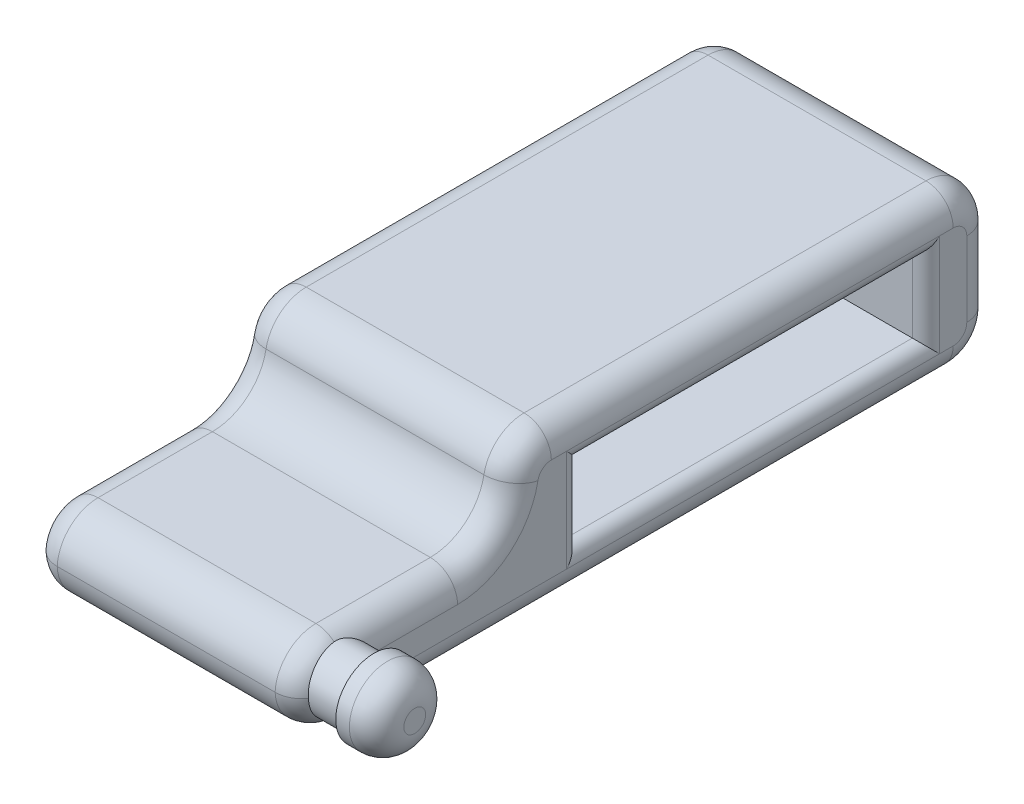
from build123d import *

# Parameters (mm, degrees)
SKETCH1_W           = 20
SKETCH1_H           = 25.4
BOSS_EXTRUDE1_DEPTH = 11.5
SKETCH1_3_W         = 20
SKETCH1_3_H         = 25.4
BOSS_EXTRUDE2_DEPTH = 5.75
SKETCH3_W           = 20
SKETCH3_H           = 5.75
BOSS_EXTRUDE3_DEPTH = 10
SKETCH4_W           = 25.4
SKETCH4_H           = 5.5
CUT_EXTRUDE1_DEPTH  = 43.233437778
FILLET1_R           = 1
FILLET2_R           = 1
FILLET3_R           = 3
FILLET4_R           = 3
FILLET5_R           = 4
FILLET6_R           = 3
SKETCH6_R           = 2.299110901
BOSS_EXTRUDE4_DEPTH = 2
FILLET7_R           = 3
SKETCH8_R           = 2.8
BOSS_EXTRUDE6_DEPTH = 3
FILLET9_R           = 2
FILLET10_R          = 2
FILLET11_R          = 2


with BuildPart() as part:
    # Sketch1 → Boss-Extrude1 (new body)
    with BuildSketch(Plane(origin=(0, 0, 0), x_dir=(1, 0, 0), z_dir=(0, 1, 0))):
        with Locations((10.626362144, 2.72467998)):
            Rectangle(SKETCH1_W, SKETCH1_H)
    extrude(amount=BOSS_EXTRUDE1_DEPTH)

    # Sketch1<3> → Boss-Extrude2 (add)
    with BuildSketch(Plane(origin=(0, 0, 0), x_dir=(1, 0, 0), z_dir=(0, 1, 0))):
        with Locations((10.626362144, -22.67532002)):
            Rectangle(SKETCH1_3_W, SKETCH1_3_H)
    extrude(amount=BOSS_EXTRUDE2_DEPTH)

    # Sketch3 → Boss-Extrude3 (add)
    with BuildSketch(Plane.XY.offset(9.97532002)):
        with Locations((10.626362144, 8.625)):
            Rectangle(SKETCH3_W, SKETCH3_H)
    extrude(amount=BOSS_EXTRUDE3_DEPTH)

    # Sketch4 → Cut-Extrude1 (cut, through all)
    with BuildSketch(Plane(origin=(20.626362144, 0, 0), x_dir=(0, 0, -1), z_dir=(1, 0, 0))):
        with Locations((-2.27532002, 5.75)):
            Rectangle(SKETCH4_W, SKETCH4_H)
    extrude(amount=-CUT_EXTRUDE1_DEPTH, mode=Mode.SUBTRACT)

    # Fillet1
    fillet1_edges = [part.edges().sort_by_distance(p)[0] for p in [
        (20.626362144, 5.75, 14.97532002),
        (20.626362144, 3, 2.27532002),
        (20.626362144, 5.75, -10.42467998),
        (20.626362144, 8.5, 2.27532002),
    ]]
    fillet(fillet1_edges, radius=FILLET1_R)

    # Fillet2
    fillet2_edges = [part.edges().sort_by_distance(p)[0] for p in [
        (0.626362144, 5.75, 14.97532002),
        (0.626362144, 8.5, 2.27532002),
        (0.626362144, 5.75, -10.42467998),
        (0.626362144, 3, 2.27532002),
    ]]
    fillet(fillet2_edges, radius=FILLET2_R)

    # Fillet3
    fillet3_edges = [part.edges().sort_by_distance(p)[0] for p in [
        (10.626362144, 11.5, -15.42467998),
    ]]
    fillet(fillet3_edges, radius=FILLET3_R)

    # Fillet4
    fillet4_edges = [part.edges().sort_by_distance(p)[0] for p in [
        (10.626362144, 0, -15.42467998),
    ]]
    fillet(fillet4_edges, radius=FILLET4_R)

    # Fillet5
    fillet5_edges = [part.edges().sort_by_distance(p)[0] for p in [
        (10.626362144, 5.75, 19.97532002),
    ]]
    fillet(fillet5_edges, radius=FILLET5_R)

    # Fillet6
    fillet6_edges = [part.edges().sort_by_distance(p)[0] for p in [
        (10.626362144, 11.5, 19.97532002),
    ]]
    fillet(fillet6_edges, radius=FILLET6_R)

    # Sketch6 → Boss-Extrude4 (add)
    with BuildSketch(Plane(origin=(20.626362144, 0, 0), x_dir=(0, 0, -1), z_dir=(1, 0, 0))):
        with Locations((-32.243815698, 2.949635855)):
            Circle(SKETCH6_R)
    extrude(amount=BOSS_EXTRUDE4_DEPTH)

    # Fillet7
    # the kernel refuses this fillet: 3 mm, written as the material it takes off along each edge
    with BuildSketch(Plane(origin=(-6.873637856, 0, 35.37532002), x_dir=(0, 1, 0), z_dir=(1, 0, 0)), Plane(origin=(-6.873637856, 5.75, 35.37532002), x_dir=(0, 0, -1), z_dir=(1, 0, 0))) as fillet7_piece_1:
        with BuildLine():
            CenterArc((FILLET7_R, -FILLET7_R), FILLET7_R, 90, 90)
            Line((0, -FILLET7_R), (0, 0))
            Line((0, 0), (FILLET7_R, 0))
        make_face()
    extrude(amount=35, mode=Mode.SUBTRACT)

    # Sketch8 → Boss-Extrude6 (add)
    with BuildSketch(Plane(origin=(22.626362144, 0, 0), x_dir=(0, 0, -1), z_dir=(1, 0, 0))):
        with Locations((-32.118132116, 2.923606681)):
            Circle(SKETCH8_R)
    extrude(amount=BOSS_EXTRUDE6_DEPTH)

    # Fillet9
    fillet9_edges = [part.edges().sort_by_distance(p)[0] for p in [
        (25.626362144, 2.923606681, 34.918132116),
    ]]
    fillet(fillet9_edges, radius=FILLET9_R)

    # Fillet10
    # the kernel refuses this fillet: 2 mm, written as the material it takes off along each edge
    with BuildSketch(Plane(origin=(0.626362144, 9.75, 23.97532002), x_dir=(0, -0.17857142857142888, -0.9839269509968508), z_dir=(0, 0.9839269509968508, -0.17857142857142888))) as fillet10_piece_1:
        with BuildLine():
            CenterArc((4 + FILLET10_R, -FILLET10_R), FILLET10_R, 90, 90)
            Line((4 + FILLET10_R, 0), (4, 0))
            Line((4, 0), (4, -FILLET10_R))
        make_face()
    revolve(axis=Axis((0.626362144, 9.75, 23.97532002), (-1, 0, 0)), revolution_arc=79.713439389, mode=Mode.SUBTRACT)
    with BuildSketch(Plane(origin=(0.626362144, 8.500000013, 17.087831374), x_dir=(0, 0.17857142509559704, 0.9839269516276742), z_dir=(0, -0.9839269516276742, 0.17857142509559704))) as fillet10_piece_2:
        with BuildLine():
            CenterArc((2.999999987 - FILLET10_R * 1.00000000192, -FILLET10_R), FILLET10_R, 360, 90)
            Line((2.999999987 - FILLET10_R * 1.00000000192, 0), (2.999999987, 0))
            Line((2.999999987, 0), (2.999999987 - FILLET10_R * 1.92114524289e-09, -FILLET10_R))
        make_face()
    revolve(axis=Axis((0.626362144, 8.500000013, 17.087831374), (-1, 0, 0)), revolution_arc=79.713439793, mode=Mode.SUBTRACT)
    with BuildSketch(Plane(origin=(0.626362144, 2.75, 32.37532002), x_dir=(0, -0.9984974283407907, -0.05479859119382269), z_dir=(0, 0.05479859119382269, -0.9984974283407907))) as fillet10_piece_3:
        with BuildLine():
            CenterArc((3 - FILLET10_R, -FILLET10_R), FILLET10_R, 0, 90)
            Line((3 - FILLET10_R, 0), (3, 0))
            Line((3, 0), (3, -FILLET10_R))
        make_face()
    revolve(axis=Axis((0.626362144, 2.75, 32.37532002), (-1, 0, 0)), revolution_arc=183.1413015, mode=Mode.SUBTRACT)
    with BuildSketch(Plane(origin=(0.626362144, 3, 32.37532002), x_dir=(0, -1, 0), z_dir=(0, 0, -1))) as fillet10_piece_4:
        with BuildLine():
            CenterArc((3 - FILLET10_R, -FILLET10_R), FILLET10_R, 0, 90)
            Line((3 - FILLET10_R, 0), (3, 0))
            Line((3, 0), (3, -FILLET10_R))
        make_face()
    revolve(axis=Axis((0.626362144, 3, 32.37532002), (-1, 0, 0)), revolution_arc=183.1413015, mode=Mode.SUBTRACT)
    with BuildSketch(Plane(origin=(0.626362144, 3, -15.42467998), x_dir=(1, 0, 0), z_dir=(0, 1, 0))) as fillet10_piece_5:
        with BuildLine():
            CenterArc((FILLET10_R, -FILLET10_R), FILLET10_R, 90, 90)
            Line((0, -FILLET10_R), (0, 0))
            Line((0, 0), (FILLET10_R, 0))
        make_face()
    extrude(amount=5.5, mode=Mode.SUBTRACT)
    with BuildSketch(Plane(origin=(0.626362144, 11.5, 17.087831364), x_dir=(1, 0, 0), z_dir=(0, 0, -1))) as fillet10_piece_6:
        with BuildLine():
            CenterArc((FILLET10_R, FILLET10_R), FILLET10_R, 180, 90)
            Line((0, FILLET10_R), (0, 0))
            Line((0, 0), (FILLET10_R, 0))
        make_face()
    extrude(amount=29.512511343, mode=Mode.SUBTRACT)
    with BuildSketch(Plane(origin=(0.626362144, 8.5, -12.42467998), x_dir=(0, 0, -1), z_dir=(0, -1, 0))) as fillet10_piece_7:
        with BuildLine():
            CenterArc((3 - FILLET10_R, FILLET10_R), FILLET10_R, 270, 90)
            Line((3 - FILLET10_R, 0), (3, 0))
            Line((3, 0), (3, FILLET10_R))
        make_face()
    revolve(axis=Axis((0.626362144, 8.5, -12.42467998), (1, 0, 0)), revolution_arc=90, mode=Mode.SUBTRACT)
    with BuildSketch(Plane(origin=(0.626362144, 0, -12.42467998), x_dir=(1, 0, 0), z_dir=(0, 0, 1))) as fillet10_piece_8:
        with BuildLine():
            CenterArc((FILLET10_R, FILLET10_R), FILLET10_R, 180, 90)
            Line((0, FILLET10_R), (0, 0))
            Line((0, 0), (FILLET10_R, 0))
        make_face()
    extrude(amount=44.8, mode=Mode.SUBTRACT)
    with BuildSketch(Plane(origin=(0.626362144, 3, -12.42467998), x_dir=(0, 0, -1), z_dir=(0, 1, 0))) as fillet10_piece_9:
        with BuildLine():
            CenterArc((3 - FILLET10_R, -FILLET10_R), FILLET10_R, 0, 90)
            Line((3 - FILLET10_R, 0), (3, 0))
            Line((3, 0), (3, -FILLET10_R))
        make_face()
    revolve(axis=Axis((0.626362144, 3, -12.42467998), (-1, 0, 0)), revolution_arc=90, mode=Mode.SUBTRACT)
    with BuildSketch(Plane(origin=(0.626362144, 5.75, 23.97532002), x_dir=(1, 0, 0), z_dir=(0, 0, 1))) as fillet10_piece_10:
        with BuildLine():
            CenterArc((FILLET10_R, -FILLET10_R), FILLET10_R, 90, 90)
            Line((0, -FILLET10_R), (0, 0))
            Line((0, 0), (FILLET10_R, 0))
        make_face()
    extrude(amount=8.4, mode=Mode.SUBTRACT)

    # Fillet11
    # the kernel refuses this fillet: 2 mm, written as the material it takes off along each edge
    with BuildSketch(Plane(origin=(20.626362144, 0, 32.37532002), x_dir=(0, 1, 0), z_dir=(0, 0, -1))) as fillet11_piece_1_section:
        with BuildLine():
            CenterArc((FILLET11_R, -FILLET11_R), FILLET11_R, 90, 90)
            Line((0, -FILLET11_R), (0, 0))
            Line((0, 0), (FILLET11_R, 0))
        make_face()
    fillet11_piece_1 = extrude(amount=44.8, mode=Mode.PRIVATE)
    fillet11_piece_1 = fillet11_piece_1 - Plane(origin=(20.626362144, 2.949635855, 32.243815698), x_dir=(0, 0, -1), z_dir=(-1, 0, 0)) * Cylinder(2.299110901, 98, mode=Mode.PRIVATE)
    add(fillet11_piece_1, mode=Mode.SUBTRACT)
    with BuildSketch(Plane(origin=(20.626362144, 3, -12.42467998), x_dir=(0, 0, -1), z_dir=(0, 1, 0))) as fillet11_piece_2:
        with BuildLine():
            CenterArc((3 - FILLET11_R, FILLET11_R), FILLET11_R, 270, 90)
            Line((3, FILLET11_R), (3, 0))
            Line((3, 0), (3 - FILLET11_R, 0))
        make_face()
    revolve(axis=Axis((20.626362144, 3, -12.42467998), (-1, 0, 0)), revolution_arc=90, mode=Mode.SUBTRACT)
    with BuildSketch(Plane(origin=(20.626362144, 3, -15.42467998), x_dir=(0, 0, 1), z_dir=(0, 1, 0))) as fillet11_piece_3:
        with BuildLine():
            CenterArc((FILLET11_R, -FILLET11_R), FILLET11_R, 90, 90)
            Line((0, -FILLET11_R), (0, 0))
            Line((0, 0), (FILLET11_R, 0))
        make_face()
    extrude(amount=5.5, mode=Mode.SUBTRACT)
    with BuildSketch(Plane(origin=(20.626362144, 8.5, -12.42467998), x_dir=(0, 0, -1), z_dir=(0, -1, 0))) as fillet11_piece_4:
        with BuildLine():
            CenterArc((3 - FILLET11_R, -FILLET11_R), FILLET11_R, 0, 90)
            Line((3, -FILLET11_R), (3, 0))
            Line((3, 0), (3 - FILLET11_R, 0))
        make_face()
    revolve(axis=Axis((20.626362144, 8.5, -12.42467998), (1, 0, 0)), revolution_arc=90, mode=Mode.SUBTRACT)
    with BuildSketch(Plane(origin=(20.626362144, 5.75, 32.37532002), x_dir=(0, -1, 0), z_dir=(0, 0, -1))) as fillet11_piece_5_section:
        with BuildLine():
            CenterArc((FILLET11_R, FILLET11_R), FILLET11_R, 180, 90)
            Line((0, FILLET11_R), (0, 0))
            Line((0, 0), (FILLET11_R, 0))
        make_face()
    fillet11_piece_5 = extrude(amount=8.4, mode=Mode.PRIVATE)
    fillet11_piece_5 = fillet11_piece_5 - Plane(origin=(20.626362144, 2.949635855, 32.243815698), x_dir=(0, 0, -1), z_dir=(-1, 0, 0)) * Cylinder(2.299110901, 25, mode=Mode.PRIVATE)
    add(fillet11_piece_5, mode=Mode.SUBTRACT)
    with BuildSketch(Plane(origin=(20.626362144, 9.75, 23.97532002), x_dir=(0, -0.17857142857142888, -0.9839269509968508), z_dir=(0, 0.9839269509968508, -0.17857142857142888))) as fillet11_piece_6:
        with BuildLine():
            CenterArc((4 + FILLET11_R, FILLET11_R), FILLET11_R, 180, 90)
            Line((4, FILLET11_R), (4, 0))
            Line((4, 0), (4 + FILLET11_R, 0))
        make_face()
    revolve(axis=Axis((20.626362144, 9.75, 23.97532002), (-1, 0, 0)), revolution_arc=79.713439389, mode=Mode.SUBTRACT)
    with BuildSketch(Plane(origin=(20.626362144, 8.500000013, 17.087831374), x_dir=(0, 0.178571425095601, 0.9839269516276735), z_dir=(0, -0.9839269516276735, 0.178571425095601))) as fillet11_piece_7:
        with BuildLine():
            CenterArc((2.999999987 - FILLET11_R * 1.00000000192, FILLET11_R), FILLET11_R, 270, 90)
            Line((2.999999987 - FILLET11_R * 1.92114324449e-09, FILLET11_R), (2.999999987, 0))
            Line((2.999999987, 0), (2.999999987 - FILLET11_R * 1.00000000192, 0))
        make_face()
    revolve(axis=Axis((20.626362144, 8.500000013, 17.087831374), (-1, 0, 0)), revolution_arc=79.713439793, mode=Mode.SUBTRACT)
    with BuildSketch(Plane(origin=(20.626362144, 11.5, 17.087831364), x_dir=(0, -1, 0), z_dir=(0, 0, -1))) as fillet11_piece_8:
        with BuildLine():
            CenterArc((FILLET11_R, FILLET11_R), FILLET11_R, 180, 90)
            Line((0, FILLET11_R), (0, 0))
            Line((0, 0), (FILLET11_R, 0))
        make_face()
    extrude(amount=29.512511343, mode=Mode.SUBTRACT)
    with BuildSketch(Plane(origin=(20.626362144, 2.75, 32.37532002), x_dir=(0, -0.9984974283407908, -0.05479859119382033), z_dir=(0, 0.05479859119382033, -0.9984974283407908))) as fillet11_piece_9_section:
        with BuildLine():
            CenterArc((3 - FILLET11_R, FILLET11_R), FILLET11_R, 270, 90)
            Line((3, FILLET11_R), (3, 0))
            Line((3, 0), (3 - FILLET11_R, 0))
        make_face()
    fillet11_piece_9 = revolve(axis=Axis((20.626362144, 2.75, 32.37532002), (-1, 0, 0)), revolution_arc=183.1413015, mode=Mode.PRIVATE)
    fillet11_piece_9 = fillet11_piece_9 - Plane(origin=(20.626362144, 2.949635855, 32.243815698), x_dir=(0, 0, -1), z_dir=(-1, 0, 0)) * Cylinder(2.299110901, 13, mode=Mode.PRIVATE)
    add(fillet11_piece_9, mode=Mode.SUBTRACT)
    with BuildSketch(Plane(origin=(20.626362144, 3, 32.37532002), x_dir=(0, -1, 0), z_dir=(0, 0, -1))) as fillet11_piece_10_section:
        with BuildLine():
            CenterArc((3 - FILLET11_R, FILLET11_R), FILLET11_R, 270, 90)
            Line((3, FILLET11_R), (3, 0))
            Line((3, 0), (3 - FILLET11_R, 0))
        make_face()
    fillet11_piece_10 = revolve(axis=Axis((20.626362144, 3, 32.37532002), (-1, 0, 0)), revolution_arc=183.1413015, mode=Mode.PRIVATE)
    fillet11_piece_10 = fillet11_piece_10 - Plane(origin=(20.626362144, 2.949635855, 32.243815698), x_dir=(0, 0, -1), z_dir=(-1, 0, 0)) * Cylinder(2.299110901, 12, mode=Mode.PRIVATE)
    add(fillet11_piece_10, mode=Mode.SUBTRACT)


solid = part.part
